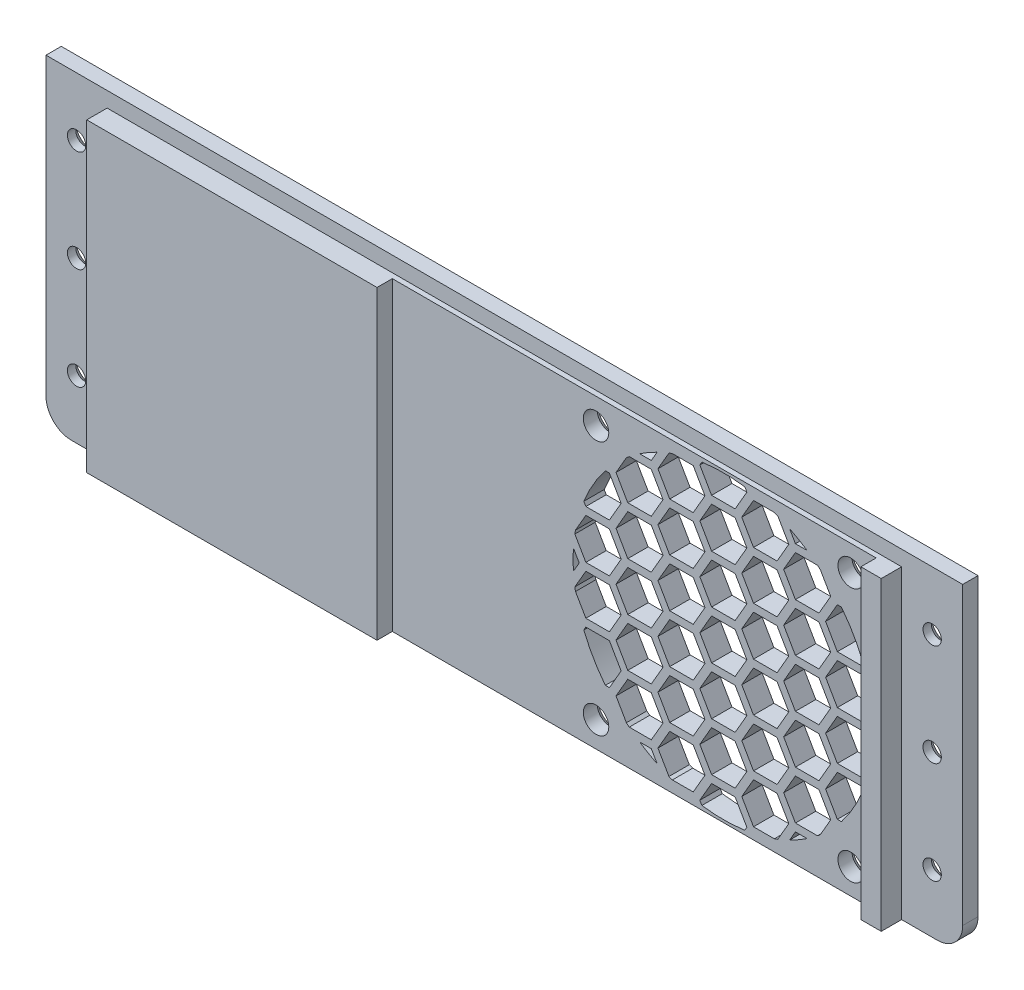
from build123d import *

# Parameters (mm, degrees)
SKETCH1_W                                       = 180
SKETCH1_H                                       = 63
BOSS_EXTRUDE1_DEPTH                             = 3
FILLET1_R                                       = 5
SKETCH2_W                                       = 156
SKETCH2_H                                       = 63
BOSS_EXTRUDE2_DEPTH                             = 4
CSK_FOR_M3_FLAT_HEAD_MACHINE_SCREW1_D           = 3.6
CSK_FOR_M3_FLAT_HEAD_MACHINE_SCREW1_DEPTH       = 8
CSK_FOR_M3_FLAT_HEAD_MACHINE_SCREW1_CSINK_D     = 6.3
CSK_FOR_M3_FLAT_HEAD_MACHINE_SCREW1_CSINK_ANGLE = 90
CSK_FOR_M3_FLAT_HEAD_MACHINE_SCREW1_TIP         = 1.081549114
CSK_FOR_M3_FLAT_HEAD_MACHINE_SCREW3_D           = 5
CSK_FOR_M3_FLAT_HEAD_MACHINE_SCREW3_CSINK_D     = 7.5
CSK_FOR_M3_FLAT_HEAD_MACHINE_SCREW3_CSINK_ANGLE = 90
SKETCH15_W                                      = 95
SKETCH15_H                                      = 63
CUT_EXTRUDE3_DEPTH                              = 3
SKETCH17_R                                      = 29.5
CUT_EXTRUDE7_DEPTH                              = 96.609884426
SKETCH18_W                                      = 180
SKETCH18_H                                      = 8
CUT_EXTRUDE8_DEPTH                              = 3
SKETCH20_W                                      = 30
SKETCH20_H                                      = 59
CUT_EXTRUDE9_DEPTH                              = 96.609884426
BOSS_EXTRUDE3_START                             = -4
BOSS_EXTRUDE3_DEPTH                             = 4
SKETCH20_2_W                                    = 30
SKETCH20_2_H                                    = 59
BOSS_EXTRUDE4_DEPTH                             = 4


# Read off the part's stored shape, not the designer's step: Boss-Extrude3
with BuildPart() as part:
    # Sketch1 → Boss-Extrude1 (new body)
    with BuildSketch(Plane.XY):
        Rectangle(SKETCH1_W, SKETCH1_H)
    extrude(amount=BOSS_EXTRUDE1_DEPTH)

    # Fillet1
    fillet1_edges = [part.edges().sort_by_distance(p)[0] for p in [
        (90, -31.5, 1.5),
        (-90, -31.5, 1.5),
    ]]
    fillet(fillet1_edges, radius=FILLET1_R)

    # Sketch2 → Boss-Extrude2 (add)
    with BuildSketch(Plane.XY.offset(3)):
        Rectangle(SKETCH2_W, SKETCH2_H)
    extrude(amount=BOSS_EXTRUDE2_DEPTH)

    # CSK for M3 Flat Head Machine Screw1
    with Locations(Plane(origin=(0, 0, 0), x_dir=(-1, 0, 0), z_dir=(0, 0, -1))):
        with Locations((-84, 20), (-84, -20), (84, 20), (84, -20), (-84, 0), (84, 0)):
            CounterSinkHole(CSK_FOR_M3_FLAT_HEAD_MACHINE_SCREW1_D / 2, CSK_FOR_M3_FLAT_HEAD_MACHINE_SCREW1_CSINK_D / 2, depth=CSK_FOR_M3_FLAT_HEAD_MACHINE_SCREW1_DEPTH, counter_sink_angle=CSK_FOR_M3_FLAT_HEAD_MACHINE_SCREW1_CSINK_ANGLE)
            with Locations((0, 0, -(CSK_FOR_M3_FLAT_HEAD_MACHINE_SCREW1_DEPTH + CSK_FOR_M3_FLAT_HEAD_MACHINE_SCREW1_TIP / 2))):  # 118° drill point
                Cone(0, CSK_FOR_M3_FLAT_HEAD_MACHINE_SCREW1_D / 2, CSK_FOR_M3_FLAT_HEAD_MACHINE_SCREW1_TIP, mode=Mode.SUBTRACT)

    # CSK for M3 Flat Head Machine Screw3 (through all)
    with Locations(Plane(origin=(0, 0, 0), x_dir=(-1, 0, 0), z_dir=(0, 0, -1))):
        with Locations((-19, 23.5), (-19, -26.5), (-69, -26.5), (-69, 23.5)):
            CounterSinkHole(CSK_FOR_M3_FLAT_HEAD_MACHINE_SCREW3_D / 2, CSK_FOR_M3_FLAT_HEAD_MACHINE_SCREW3_CSINK_D / 2, counter_sink_angle=CSK_FOR_M3_FLAT_HEAD_MACHINE_SCREW3_CSINK_ANGLE)

    # Sketch15 → Cut-Extrude3 (cut)
    with BuildSketch(Plane.XY.offset(7)):
        with Locations((26.5, 0)):
            Rectangle(SKETCH15_W, SKETCH15_H)
    extrude(amount=-CUT_EXTRUDE3_DEPTH, mode=Mode.SUBTRACT)

    # Sketch17 → Cut-Extrude7 (cut, through all)
    with BuildSketch(Plane(origin=(0, 0, 0), x_dir=(-1, 0, 0), z_dir=(0, 0, -1))):
        with Locations((-44, -1.5)):
            Circle(SKETCH17_R)
    extrude(amount=-CUT_EXTRUDE7_DEPTH, mode=Mode.SUBTRACT)

    # Sketch18 → Cut-Extrude8 (cut)
    with BuildSketch(Plane(origin=(0, 31.5, 0), x_dir=(1, 0, 0), z_dir=(0, 1, 0))):
        with Locations((0, -7)):
            Rectangle(SKETCH18_W, SKETCH18_H)
    extrude(amount=-CUT_EXTRUDE8_DEPTH, mode=Mode.SUBTRACT)

    # Sketch20 → Cut-Extrude9 (cut, through all)
    with BuildSketch(Plane(origin=(0, 0, 0), x_dir=(-1, 0, 0), z_dir=(0, 0, -1))):
        with Locations((5, -1.5)):
            Rectangle(SKETCH20_W, SKETCH20_H)
    extrude(amount=-CUT_EXTRUDE9_DEPTH, mode=Mode.SUBTRACT)

    # Boss-Extrude3 outline → Boss-Extrude3 (add)
    # profile 1 of 2: a face of its own
    with BuildSketch(Plane(origin=(0, 0, 0), x_dir=(-1, 0, 0), z_dir=(0, 0, -1)).offset(BOSS_EXTRUDE3_START)):
        Polygon((-10, 2.5), (-8.770598923, 2.5), (-6.461197846, -1.5), (-8.770598923, -5.5), (-10, -5.5), (-10, -7), (-8.770598923, -7), (-6.461197846, -11), (-8.770598923, -15), (-10, -15), (-10, -16.5), (-8.770598923, -16.5), (-6.461197846, -20.5), (-8.770598923, -24.5), (-10, -24.5), (-10, -26), (-8.770598923, -26), (-6.461197846, -30), (-7.038548116, -31), (1.338548116, -31), (0.761197846, -30), (3.070598923, -26), (7.689401077, -26), (9.998802154, -30), (9.421451884, -31), (17.798548116, -31), (17.221197846, -30), (19.530598923, -26), (20, -26), (20, -24.5), (19.530598923, -24.5), (17.221197846, -20.5), (19.530598923, -16.5), (20, -16.5), (20, -15), (19.530598923, -15), (17.221197846, -11), (19.530598923, -7), (20, -7), (20, -5.5), (19.530598923, -5.5), (17.221197846, -1.5), (19.530598923, 2.5), (20, 2.5), (20, 4), (19.530598923, 4), (17.221197846, 8), (19.530598923, 12), (20, 12), (20, 13.5), (19.530598923, 13.5), (17.221197846, 17.5), (19.530598923, 21.5), (20, 21.5), (20, 23), (19.530598923, 23), (17.221197846, 27), (17.798548116, 28), (9.421451884, 28), (9.998802154, 27), (7.689401077, 23), (3.070598923, 23), (0.761197846, 27), (1.338548116, 28), (-7.038548116, 28), (-6.461197846, 27), (-8.770598923, 23), (-10, 23), (-10, 21.5), (-8.770598923, 21.5), (-6.461197846, 17.5), (-8.770598923, 13.5), (-10, 13.5), (-10, 12), (-8.770598923, 12), (-6.461197846, 8), (-8.770598923, 4), (-10, 4), align=None)
        Polygon((-5.162159741, -21.25), (-0.543357587, -21.25), (1.766043489, -25.25), (-0.543357587, -29.25), (-5.162159741, -29.25), (-7.471560818, -25.25), align=None, mode=Mode.SUBTRACT)
        Polygon((11.297840259, -21.25), (15.916642413, -21.25), (18.226043489, -25.25), (15.916642413, -29.25), (11.297840259, -29.25), (8.988439182, -25.25), align=None, mode=Mode.SUBTRACT)
        Polygon((3.070598923, -16.5), (7.689401077, -16.5), (9.998802154, -20.5), (7.689401077, -24.5), (3.070598923, -24.5), (0.761197846, -20.5), align=None, mode=Mode.SUBTRACT)
        Polygon((-5.162159741, -11.75), (-0.543357587, -11.75), (1.766043489, -15.75), (-0.543357587, -19.75), (-5.162159741, -19.75), (-7.471560818, -15.75), align=None, mode=Mode.SUBTRACT)
        Polygon((3.070598923, -7), (7.689401077, -7), (9.998802154, -11), (7.689401077, -15), (3.070598923, -15), (0.761197846, -11), align=None, mode=Mode.SUBTRACT)
        Polygon((11.297840259, -11.75), (15.916642413, -11.75), (18.226043489, -15.75), (15.916642413, -19.75), (11.297840259, -19.75), (8.988439182, -15.75), align=None, mode=Mode.SUBTRACT)
        Polygon((-5.162159741, -2.25), (-0.543357587, -2.25), (1.766043489, -6.25), (-0.543357587, -10.25), (-5.162159741, -10.25), (-7.471560818, -6.25), align=None, mode=Mode.SUBTRACT)
        Polygon((11.297840259, -2.25), (15.916642413, -2.25), (18.226043489, -6.25), (15.916642413, -10.25), (11.297840259, -10.25), (8.988439182, -6.25), align=None, mode=Mode.SUBTRACT)
        Polygon((3.070598923, 2.5), (7.689401077, 2.5), (9.998802154, -1.5), (7.689401077, -5.5), (3.070598923, -5.5), (0.761197846, -1.5), align=None, mode=Mode.SUBTRACT)
        Polygon((-5.162159741, 7.25), (-0.543357587, 7.25), (1.766043489, 3.25), (-0.543357587, -0.75), (-5.162159741, -0.75), (-7.471560818, 3.25), align=None, mode=Mode.SUBTRACT)
        Polygon((11.297840259, 7.25), (15.916642413, 7.25), (18.226043489, 3.25), (15.916642413, -0.75), (11.297840259, -0.75), (8.988439182, 3.25), align=None, mode=Mode.SUBTRACT)
        Polygon((3.070598923, 12), (7.689401077, 12), (9.998802154, 8), (7.689401077, 4), (3.070598923, 4), (0.761197846, 8), align=None, mode=Mode.SUBTRACT)
        Polygon((-5.162159741, 16.75), (-0.543357587, 16.75), (1.766043489, 12.75), (-0.543357587, 8.75), (-5.162159741, 8.75), (-7.471560818, 12.75), align=None, mode=Mode.SUBTRACT)
        Polygon((11.297840259, 16.75), (15.916642413, 16.75), (18.226043489, 12.75), (15.916642413, 8.75), (11.297840259, 8.75), (8.988439182, 12.75), align=None, mode=Mode.SUBTRACT)
        Polygon((3.070598923, 21.5), (7.689401077, 21.5), (9.998802154, 17.5), (7.689401077, 13.5), (3.070598923, 13.5), (0.761197846, 17.5), align=None, mode=Mode.SUBTRACT)
        Polygon((-0.543357587, 18.25), (-5.162159741, 18.25), (-7.471560818, 22.25), (-5.162159741, 26.25), (-0.543357587, 26.25), (1.766043489, 22.25), align=None, mode=Mode.SUBTRACT)
        Polygon((15.916642413, 18.25), (11.297840259, 18.25), (8.988439182, 22.25), (11.297840259, 26.25), (15.916642413, 26.25), (18.226043489, 22.25), align=None, mode=Mode.SUBTRACT)
    # profile 2 of 2: a face of its own
    with BuildSketch(Plane(origin=(0, 0, 0), x_dir=(-1, 0, 0), z_dir=(0, 0, -1)).offset(BOSS_EXTRUDE3_START)):
        with BuildLine():
            Line((-71.002159741, 7.25), (-66.383357587, 7.25))
            Line((-66.383357587, 7.25), (-64.073956511, 3.25))
            Line((-64.073956511, 3.25), (-66.383357587, -0.75))
            Line((-66.383357587, -0.75), (-71.002159741, -0.75))
            Line((-71.002159741, -0.75), (-73.157384631, 2.982959011))
            ThreePointArc((-73.157384631, 2.982959011), (-73.323076078, 1.726020663), (-73.434607942, 0.46312387))
            Line((-73.434607942, 0.46312387), (-72.301197846, -1.5))
            Line((-72.301197846, -1.5), (-73.434607942, -3.46312387))
            ThreePointArc((-73.434607942, -3.46312387), (-73.323076078, -4.726020663), (-73.157384631, -5.982959011))
            Line((-73.157384631, -5.982959011), (-71.002159741, -2.25))
            Line((-71.002159741, -2.25), (-66.383357587, -2.25))
            Line((-66.383357587, -2.25), (-64.073956511, -6.25))
            Line((-64.073956511, -6.25), (-66.383357587, -10.25))
            Line((-66.383357587, -10.25), (-71.002159741, -10.25))
            Line((-71.002159741, -10.25), (-73.031899444, -6.734387708))
            ThreePointArc((-73.031899444, -6.734387708), (-72.358660898, -9.626275411), (-71.398128519, -12.435838042))
            Line((-71.398128519, -12.435838042), (-71.002159741, -11.75))
            Line((-71.002159741, -11.75), (-66.383357587, -11.75))
            Line((-66.383357587, -11.75), (-64.073956511, -15.75))
            Line((-64.073956511, -15.75), (-66.383357587, -19.75))
            Line((-66.383357587, -19.75), (-67.177305711, -19.75))
            ThreePointArc((-67.177305711, -19.75), (-65.216215637, -21.996882544), (-63.038286077, -24.034277517))
            Line((-63.038286077, -24.034277517), (-65.078802154, -20.5))
            Line((-65.078802154, -20.5), (-62.769401077, -16.5))
            Line((-62.769401077, -16.5), (-58.150598923, -16.5))
            Line((-58.150598923, -16.5), (-55.841197846, -20.5))
            Line((-55.841197846, -20.5), (-58.150598923, -24.5))
            Line((-58.150598923, -24.5), (-62.472953202, -24.5))
            ThreePointArc((-62.472953202, -24.5), (-61.468422871, -25.271920461), (-60.431676725, -26))
            Line((-60.431676725, -26), (-58.150598923, -26))
            Line((-58.150598923, -26), (-57.009485308, -27.976466759))
            ThreePointArc((-57.009485308, -27.976466759), (-55.860297918, -28.510800308), (-54.689221018, -28.995282396))
            Line((-54.689221018, -28.995282396), (-56.851560818, -25.25))
            Line((-56.851560818, -25.25), (-54.542159741, -21.25))
            Line((-54.542159741, -21.25), (-49.923357587, -21.25))
            Line((-49.923357587, -21.25), (-47.613956511, -25.25))
            Line((-47.613956511, -25.25), (-49.923357587, -29.25))
            Line((-49.923357587, -29.25), (-54.00937061, -29.25))
            ThreePointArc((-54.00937061, -29.25), (-51.149549143, -30.120516191), (-48.216310764, -30.697135537))
            Line((-48.216310764, -30.697135537), (-48.618802154, -30))
            Line((-48.618802154, -30), (-46.309401077, -26))
            Line((-46.309401077, -26), (-41.690598923, -26))
            Line((-41.690598923, -26), (-39.381197846, -30))
            Line((-39.381197846, -30), (-39.783689236, -30.697135537))
            ThreePointArc((-39.783689236, -30.697135537), (-36.850450857, -30.120516191), (-33.99062939, -29.25))
            Line((-33.99062939, -29.25), (-38.082159741, -29.25))
            Line((-38.082159741, -29.25), (-40.391560818, -25.25))
            Line((-40.391560818, -25.25), (-38.082159741, -21.25))
            Line((-38.082159741, -21.25), (-33.463357587, -21.25))
            Line((-33.463357587, -21.25), (-31.153956511, -25.25))
            Line((-31.153956511, -25.25), (-33.317892314, -28.998046756))
            ThreePointArc((-33.317892314, -28.998046756), (-32.143196001, -28.5123342), (-30.990514692, -27.976466759))
            Line((-30.990514692, -27.976466759), (-29.849401077, -26))
            Line((-29.849401077, -26), (-27.568323275, -26))
            ThreePointArc((-27.568323275, -26), (-26.531577129, -25.271920461), (-25.527046798, -24.5))
            Line((-25.527046798, -24.5), (-29.849401077, -24.5))
            Line((-29.849401077, -24.5), (-32.158802154, -20.5))
            Line((-32.158802154, -20.5), (-29.849401077, -16.5))
            Line((-29.849401077, -16.5), (-25.230598923, -16.5))
            Line((-25.230598923, -16.5), (-22.921197846, -20.5))
            Line((-22.921197846, -20.5), (-24.961713923, -24.034277517))
            ThreePointArc((-24.961713923, -24.034277517), (-22.783784363, -21.996882544), (-20.822694289, -19.75))
            Line((-20.822694289, -19.75), (-21.622159741, -19.75))
            Line((-21.622159741, -19.75), (-23.931560818, -15.75))
            Line((-23.931560818, -15.75), (-21.622159741, -11.75))
            Line((-21.622159741, -11.75), (-17.003357587, -11.75))
            Line((-17.003357587, -11.75), (-16.604127104, -12.44148748))
            ThreePointArc((-16.604127104, -12.44148748), (-15.640233737, -9.622416976), (-14.965600175, -6.720500629))
            Line((-14.965600175, -6.720500629), (-17.003357587, -10.25))
            Line((-17.003357587, -10.25), (-21.622159741, -10.25))
            Line((-21.622159741, -10.25), (-23.931560818, -6.25))
            Line((-23.931560818, -6.25), (-21.622159741, -2.25))
            Line((-21.622159741, -2.25), (-17.003357587, -2.25))
            Line((-17.003357587, -2.25), (-14.843776452, -5.99050425))
            ThreePointArc((-14.843776452, -5.99050425), (-14.677341584, -4.72981477), (-14.565392058, -3.46312387))
            Line((-14.565392058, -3.46312387), (-15.698802154, -1.5))
            Line((-15.698802154, -1.5), (-14.565392058, 0.46312387))
            ThreePointArc((-14.565392058, 0.46312387), (-14.677341584, 1.72981477), (-14.843776452, 2.99050425))
            Line((-14.843776452, 2.99050425), (-17.003357587, -0.75))
            Line((-17.003357587, -0.75), (-21.622159741, -0.75))
            Line((-21.622159741, -0.75), (-23.931560818, 3.25))
            Line((-23.931560818, 3.25), (-21.622159741, 7.25))
            Line((-21.622159741, 7.25), (-17.003357587, 7.25))
            Line((-17.003357587, 7.25), (-14.965600175, 3.720500629))
            ThreePointArc((-14.965600175, 3.720500629), (-15.640233737, 6.622416976), (-16.604127104, 9.44148748))
            Line((-16.604127104, 9.44148748), (-17.003357587, 8.75))
            Line((-17.003357587, 8.75), (-21.622159741, 8.75))
            Line((-21.622159741, 8.75), (-23.931560818, 12.75))
            Line((-23.931560818, 12.75), (-21.622159741, 16.75))
            Line((-21.622159741, 16.75), (-20.822694289, 16.75))
            ThreePointArc((-20.822694289, 16.75), (-22.783784363, 18.996882544), (-24.961713923, 21.034277517))
            Line((-24.961713923, 21.034277517), (-22.921197846, 17.5))
            Line((-22.921197846, 17.5), (-25.230598923, 13.5))
            Line((-25.230598923, 13.5), (-29.849401077, 13.5))
            Line((-29.849401077, 13.5), (-32.158802154, 17.5))
            Line((-32.158802154, 17.5), (-29.849401077, 21.5))
            Line((-29.849401077, 21.5), (-25.527046798, 21.5))
            ThreePointArc((-25.527046798, 21.5), (-26.531577129, 22.271920461), (-27.568323275, 23))
            Line((-27.568323275, 23), (-29.849401077, 23))
            Line((-29.849401077, 23), (-30.990514692, 24.976466759))
            ThreePointArc((-30.990514692, 24.976466759), (-32.143196001, 25.5123342), (-33.317892314, 25.998046756))
            Line((-33.317892314, 25.998046756), (-31.153956511, 22.25))
            Line((-31.153956511, 22.25), (-33.463357587, 18.25))
            Line((-33.463357587, 18.25), (-38.082159741, 18.25))
            Line((-38.082159741, 18.25), (-40.391560818, 22.25))
            Line((-40.391560818, 22.25), (-38.082159741, 26.25))
            Line((-38.082159741, 26.25), (-33.99062939, 26.25))
            ThreePointArc((-33.99062939, 26.25), (-36.850450857, 27.120516191), (-39.783689236, 27.697135537))
            Line((-39.783689236, 27.697135537), (-39.381197846, 27))
            Line((-39.381197846, 27), (-41.690598923, 23))
            Line((-41.690598923, 23), (-46.309401077, 23))
            Line((-46.309401077, 23), (-48.618802154, 27))
            Line((-48.618802154, 27), (-48.216310764, 27.697135537))
            ThreePointArc((-48.216310764, 27.697135537), (-51.149549143, 27.120516191), (-54.00937061, 26.25))
            Line((-54.00937061, 26.25), (-49.923357587, 26.25))
            Line((-49.923357587, 26.25), (-47.613956511, 22.25))
            Line((-47.613956511, 22.25), (-49.923357587, 18.25))
            Line((-49.923357587, 18.25), (-54.542159741, 18.25))
            Line((-54.542159741, 18.25), (-56.851560818, 22.25))
            Line((-56.851560818, 22.25), (-54.689221018, 25.995282396))
            ThreePointArc((-54.689221018, 25.995282396), (-55.860297918, 25.510800308), (-57.009485308, 24.976466759))
            Line((-57.009485308, 24.976466759), (-58.150598923, 23))
            Line((-58.150598923, 23), (-60.431676725, 23))
            ThreePointArc((-60.431676725, 23), (-61.468422871, 22.271920461), (-62.472953202, 21.5))
            Line((-62.472953202, 21.5), (-58.150598923, 21.5))
            Line((-58.150598923, 21.5), (-55.841197846, 17.5))
            Line((-55.841197846, 17.5), (-58.150598923, 13.5))
            Line((-58.150598923, 13.5), (-62.769401077, 13.5))
            Line((-62.769401077, 13.5), (-65.078802154, 17.5))
            Line((-65.078802154, 17.5), (-63.038286077, 21.034277517))
            ThreePointArc((-63.038286077, 21.034277517), (-65.216215637, 18.996882544), (-67.177305711, 16.75))
            Line((-67.177305711, 16.75), (-66.383357587, 16.75))
            Line((-66.383357587, 16.75), (-64.073956511, 12.75))
            Line((-64.073956511, 12.75), (-66.383357587, 8.75))
            Line((-66.383357587, 8.75), (-71.002159741, 8.75))
            Line((-71.002159741, 8.75), (-71.398128519, 9.435838042))
            ThreePointArc((-71.398128519, 9.435838042), (-72.358660898, 6.626275411), (-73.031899444, 3.734387708))
            Line((-73.031899444, 3.734387708), (-71.002159741, 7.25))
        make_face()
        Polygon((-39.381197846, -20.5), (-41.690598923, -24.5), (-46.309401077, -24.5), (-48.618802154, -20.5), (-46.309401077, -16.5), (-41.690598923, -16.5), align=None, mode=Mode.SUBTRACT)
        Polygon((-54.542159741, -11.75), (-49.923357587, -11.75), (-47.613956511, -15.75), (-49.923357587, -19.75), (-54.542159741, -19.75), (-56.851560818, -15.75), align=None, mode=Mode.SUBTRACT)
        Polygon((-62.769401077, -7), (-58.150598923, -7), (-55.841197846, -11), (-58.150598923, -15), (-62.769401077, -15), (-65.078802154, -11), align=None, mode=Mode.SUBTRACT)
        Polygon((-54.542159741, -2.25), (-49.923357587, -2.25), (-47.613956511, -6.25), (-49.923357587, -10.25), (-54.542159741, -10.25), (-56.851560818, -6.25), align=None, mode=Mode.SUBTRACT)
        Polygon((-39.381197846, -11), (-41.690598923, -15), (-46.309401077, -15), (-48.618802154, -11), (-46.309401077, -7), (-41.690598923, -7), align=None, mode=Mode.SUBTRACT)
        Polygon((-33.463357587, -11.75), (-31.153956511, -15.75), (-33.463357587, -19.75), (-38.082159741, -19.75), (-40.391560818, -15.75), (-38.082159741, -11.75), align=None, mode=Mode.SUBTRACT)
        Polygon((-29.849401077, -7), (-25.230598923, -7), (-22.921197846, -11), (-25.230598923, -15), (-29.849401077, -15), (-32.158802154, -11), align=None, mode=Mode.SUBTRACT)
        Polygon((-31.153956511, -6.25), (-33.463357587, -10.25), (-38.082159741, -10.25), (-40.391560818, -6.25), (-38.082159741, -2.25), (-33.463357587, -2.25), align=None, mode=Mode.SUBTRACT)
        Polygon((-62.769401077, 2.5), (-58.150598923, 2.5), (-55.841197846, -1.5), (-58.150598923, -5.5), (-62.769401077, -5.5), (-65.078802154, -1.5), align=None, mode=Mode.SUBTRACT)
        Polygon((-54.542159741, 7.25), (-49.923357587, 7.25), (-47.613956511, 3.25), (-49.923357587, -0.75), (-54.542159741, -0.75), (-56.851560818, 3.25), align=None, mode=Mode.SUBTRACT)
        Polygon((-62.769401077, 12), (-58.150598923, 12), (-55.841197846, 8), (-58.150598923, 4), (-62.769401077, 4), (-65.078802154, 8), align=None, mode=Mode.SUBTRACT)
        Polygon((-54.542159741, 16.75), (-49.923357587, 16.75), (-47.613956511, 12.75), (-49.923357587, 8.75), (-54.542159741, 8.75), (-56.851560818, 12.75), align=None, mode=Mode.SUBTRACT)
        Polygon((-39.381197846, -1.5), (-41.690598923, -5.5), (-46.309401077, -5.5), (-48.618802154, -1.5), (-46.309401077, 2.5), (-41.690598923, 2.5), align=None, mode=Mode.SUBTRACT)
        Polygon((-29.849401077, 2.5), (-25.230598923, 2.5), (-22.921197846, -1.5), (-25.230598923, -5.5), (-29.849401077, -5.5), (-32.158802154, -1.5), align=None, mode=Mode.SUBTRACT)
        Polygon((-31.153956511, 3.25), (-33.463357587, -0.75), (-38.082159741, -0.75), (-40.391560818, 3.25), (-38.082159741, 7.25), (-33.463357587, 7.25), align=None, mode=Mode.SUBTRACT)
        Polygon((-41.690598923, 12), (-39.381197846, 8), (-41.690598923, 4), (-46.309401077, 4), (-48.618802154, 8), (-46.309401077, 12), align=None, mode=Mode.SUBTRACT)
        Polygon((-29.849401077, 12), (-25.230598923, 12), (-22.921197846, 8), (-25.230598923, 4), (-29.849401077, 4), (-32.158802154, 8), align=None, mode=Mode.SUBTRACT)
        Polygon((-31.153956511, 12.75), (-33.463357587, 8.75), (-38.082159741, 8.75), (-40.391560818, 12.75), (-38.082159741, 16.75), (-33.463357587, 16.75), align=None, mode=Mode.SUBTRACT)
        Polygon((-41.690598923, 21.5), (-39.381197846, 17.5), (-41.690598923, 13.5), (-46.309401077, 13.5), (-48.618802154, 17.5), (-46.309401077, 21.5), align=None, mode=Mode.SUBTRACT)
    extrude(amount=BOSS_EXTRUDE3_DEPTH)

    # Sketch20<2> → Boss-Extrude4 (add)
    with BuildSketch(Plane(origin=(0, 0, 0), x_dir=(-1, 0, 0), z_dir=(0, 0, -1))):
        with Locations((5, -1.5)):
            Rectangle(SKETCH20_2_W, SKETCH20_2_H)
    extrude(amount=-BOSS_EXTRUDE4_DEPTH)


solid = part.part
